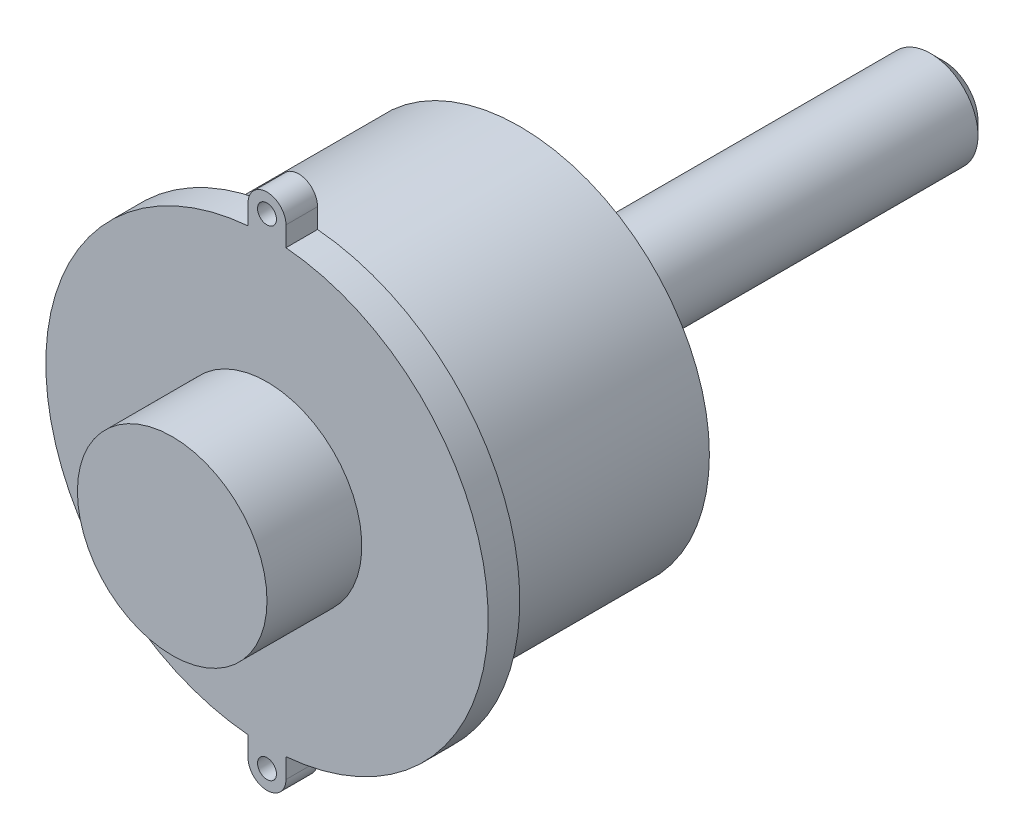
from build123d import *

# Parameters (mm, degrees)
SKETCH1_R           = 1.5
BOSS_EXTRUDE1_DEPTH = 5
SKETCH2_R           = 15
BOSS_EXTRUDE2_DEPTH = 15
SKETCH3_R           = 30
BOSS_EXTRUDE3_DEPTH = 35
SKETCH6_R           = 7.5
BOSS_EXTRUDE5_DEPTH = 60
CHAMFER2_SIZE       = 2


with BuildPart() as part:
    # Sketch1 → Boss-Extrude1 (new body)
    with BuildSketch(Plane.XY):
        with BuildLine():
            Line((-3, 38), (-3, 34.871191548))
            ThreePointArc((-3, 34.871191548), (-35, 0), (-3, -34.871191548))
            Line((-3, -34.871191548), (-3, -38))
            ThreePointArc((-3, -38), (0, -41), (3, -38))
            Line((3, -38), (3, -34.871191548))
            ThreePointArc((3, -34.871191548), (35, 0), (3, 34.871191548))
            Line((3, 34.871191548), (3, 38))
            ThreePointArc((3, 38), (0, 41), (-3, 38))
        make_face()
        with Locations((0, 38)):
            Circle(SKETCH1_R, mode=Mode.SUBTRACT)
        with Locations(Location((0, -38, 0), (0, 0, 180))):
            Circle(SKETCH1_R, mode=Mode.SUBTRACT)
    extrude(amount=-BOSS_EXTRUDE1_DEPTH)

    # Sketch2 → Boss-Extrude2 (add)
    with BuildSketch(Plane.XY):
        with Locations(Location((0, 0, 0), (0, 0, 180))):
            Circle(SKETCH2_R)
    extrude(amount=BOSS_EXTRUDE2_DEPTH)

    # Sketch3 → Boss-Extrude3 (add)
    with BuildSketch(Plane(origin=(0, 0, -5), x_dir=(-1, 0, 0), z_dir=(0, 0, -1))):
        Circle(SKETCH3_R)
    extrude(amount=BOSS_EXTRUDE3_DEPTH)

    # Loft1: read off the stored shape, not the designer's step
    # Loft1: loft between two sections, ruled curve by curve
    loft1_from = [
        Edge.make_bspline([(4.132315812, 9.106259717, -40), (22.344835246, 0.841628092, -40), (14.080203621, -17.370891341, -40), (-4.132315812, -9.106259717, -40), (-22.344835246, -0.841628092, -40), (-14.080203621, 17.370891341, -40), (4.132315812, 9.106259717, -40)], [0, 0, 0, 0, 0.5, 0.5, 0.5, 1, 1, 1, 1], 3, [1, 0.333333333, 0.333333333, 1, 0.333333333, 0.333333333, 1]),
    ]
    loft1_to = [
        Edge.make_bspline([(5.329891047, 5.276576677, -47), (15.8830444, -5.383205418, -47), (5.223262306, -15.936358771, -47), (-5.329891047, -5.276576677, -47), (-15.8830444, 5.383205418, -47), (-5.223262306, 15.936358771, -47), (5.329891047, 5.276576677, -47)], [0, 0, 0, 0, 0.5, 0.5, 0.5, 1, 1, 1, 1], 3, [1, 0.333333333, 0.333333333, 1, 0.333333333, 0.333333333, 1]),
    ]
    loft1 = Solid(Shell([*[Face.make_surface_from_curves(loft1_from[k], loft1_to[k]) for k in range(1)], Face(Wire(loft1_from)), Face(Wire(loft1_to))]))
    add(loft1)

    # Sketch6 → Boss-Extrude5 (add)
    with BuildSketch(Plane(origin=(0, 0, -47), x_dir=(-1, 0, 0), z_dir=(0, 0, -1))):
        with Locations(Location((0, 0, 0), (0, 0, 135.288))):
            Circle(SKETCH6_R)
    extrude(amount=BOSS_EXTRUDE5_DEPTH)

    # Chamfer2
    chamfer2_edges = [part.edges().sort_by_distance(p)[0] for p in [
        (-5.329891047, -5.276576677, -107),
    ]]
    chamfer(chamfer2_edges, length=CHAMFER2_SIZE)


solid = part.part
